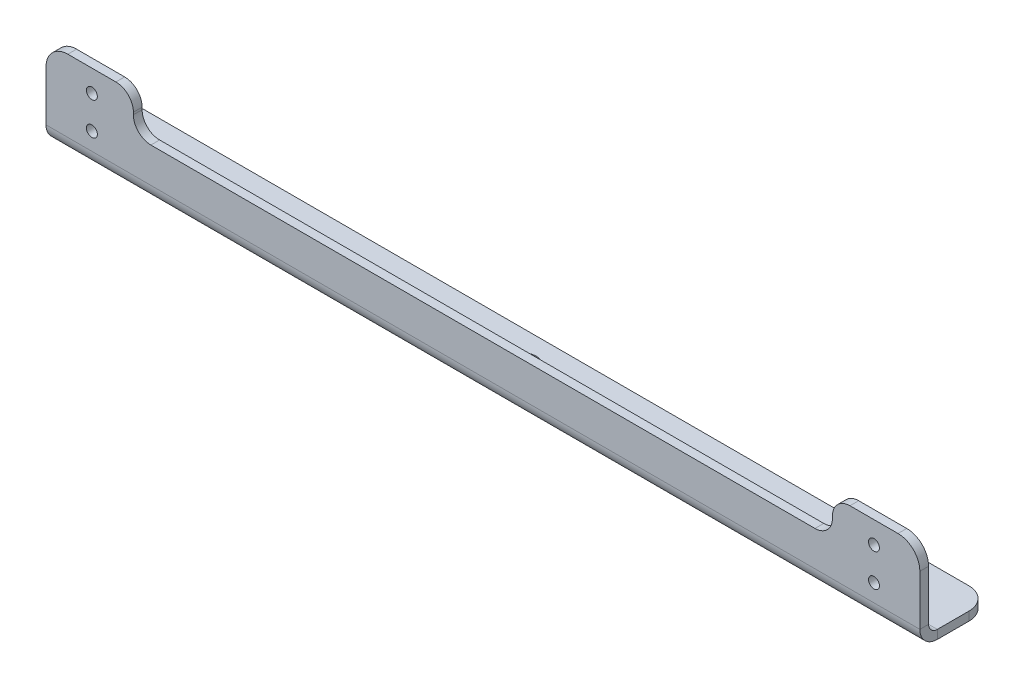
from build123d import *

# Parameters (mm, degrees)
BRIDA_BASE1_DEPTH             = 4
PLIEGUE_START                 = -1.07192
PLIEGUE_CROQUIZADO1_OUTLINE_W = 400
PLIEGUE_CROQUIZADO1_OUTLINE_H = 4
PLIEGUE_CROQUIZADO1_DEPTH     = 33.82192
PLIEGUE_START_2               = -4.25
PLIEGUE_CROQUIZADO1_2_DEPTH   = 0.02192
PLIEGUE_START_3               = -8.25
PLIEGUE_CROQUIZADO1_3_DEPTH   = 8
PLIEGUE_START_4               = -200
PLIEGUE_CROQUIZADO1_4_DEPTH   = 400
CROQUIS8_R                    = 7
CORTAR_EXTRUIR2_DEPTH         = 10
CORTAR_EXTRUIR3_REACH         = 207.381
CROQUIS9_R                    = 2.5


with BuildPart() as part:
    # Brida base1: sheet metal written as solids
    # Croquis1 → Brida base1 (new body)
    with BuildSketch(Plane(origin=(0, 0, 0), x_dir=(1, 0, 0), z_dir=(0, 1, 0))):
        with BuildLine():
            Line((168, -32.75), (190, -32.75))
            ThreePointArc((190, -32.75), (197.071067812, -29.821067812), (200, -22.75))
            Line((200, -22.75), (200, 22.75))
            ThreePointArc((200, 22.75), (197.071067812, 29.821067812), (190, 32.75))
            Line((190, 32.75), (-190, 32.75))
            ThreePointArc((-190, 32.75), (-197.071067812, 29.821067812), (-200, 22.75))
            Line((-200, 22.75), (-200, -22.75))
            ThreePointArc((-200, -22.75), (-197.071067812, -29.821067812), (-190, -32.75))
            Line((-190, -32.75), (-168, -32.75))
            ThreePointArc((-168, -32.75), (-162.343145751, -30.406854249), (-160, -24.75))
            Line((-160, -24.75), (-160, -23.75))
            ThreePointArc((-160, -23.75), (-157.656854249, -18.093145751), (-152, -15.75))
            Line((-152, -15.75), (152, -15.75))
            ThreePointArc((152, -15.75), (157.656854249, -18.093145751), (160, -23.75))
            Line((160, -23.75), (160, -24.75))
            ThreePointArc((160, -24.75), (162.343145751, -30.406854249), (168, -32.75))
        make_face()
    extrude(amount=-BRIDA_BASE1_DEPTH)

    # Pliegue croquizado1: read off the stored shape, not the designer's step
    # Pliegue croquizado1 outline → Pliegue croquizado1 (cut)
    with BuildSketch(Plane.XY.offset(PLIEGUE_START)):
        with Locations((0, -2)):
            Rectangle(PLIEGUE_CROQUIZADO1_OUTLINE_W, PLIEGUE_CROQUIZADO1_OUTLINE_H)
    extrude(amount=PLIEGUE_CROQUIZADO1_DEPTH, mode=Mode.SUBTRACT)

    # Pliegue croquizado1 2 outline → Pliegue croquizado1 2 (add)
    with BuildSketch(Plane.XY.offset(PLIEGUE_START_2)):
        with BuildLine():
            ThreePointArc((-190, 36.999999998), (-197.071067812, 34.07106781), (-200, 26.999999998))
            Line((-200, 26.999999998), (-200, 0))
            Line((-200, 0), (200, 0))
            Line((200, 0), (200, 26.999999998))
            ThreePointArc((200, 26.999999998), (197.071067812, 34.07106781), (190, 36.999999998))
            Line((190, 36.999999998), (168, 36.999999998))
            ThreePointArc((168, 36.999999998), (162.343145751, 34.656854247), (160, 28.999999998))
            Line((160, 28.999999998), (160, 27.999999998))
            ThreePointArc((160, 27.999999998), (157.656854249, 22.343145749), (152, 19.999999998))
            Line((152, 19.999999998), (-152, 19.999999998))
            ThreePointArc((-152, 19.999999998), (-157.656854249, 22.343145749), (-160, 27.999999998))
            Line((-160, 27.999999998), (-160, 28.999999998))
            ThreePointArc((-160, 28.999999998), (-162.343145751, 34.656854248), (-168, 36.999999998))
            Line((-168, 36.999999998), (-190, 36.999999998))
        make_face()
    extrude(amount=PLIEGUE_CROQUIZADO1_2_DEPTH)

    # Pliegue croquizado1 3 outline → Pliegue croquizado1 3 (add)
    with BuildSketch(Plane.XY.offset(PLIEGUE_START_3)):
        with BuildLine():
            ThreePointArc((-190, 36.999999998), (-197.071067812, 34.07106781), (-200, 26.999999998))
            Line((-200, 26.999999998), (-200, 0))
            Line((-200, 0), (200, 0))
            Line((200, 0), (200, 26.999999998))
            ThreePointArc((200, 26.999999998), (197.071067812, 34.07106781), (190, 36.999999998))
            Line((190, 36.999999998), (168, 36.999999998))
            ThreePointArc((168, 36.999999998), (162.343145751, 34.656854247), (160, 28.999999998))
            Line((160, 28.999999998), (160, 27.999999998))
            ThreePointArc((160, 27.999999998), (157.656854249, 22.343145749), (152, 19.999999998))
            Line((152, 19.999999998), (-152, 19.999999998))
            ThreePointArc((-152, 19.999999998), (-157.656854249, 22.343145749), (-160, 27.999999998))
            Line((-160, 27.999999998), (-160, 28.999999998))
            ThreePointArc((-160, 28.999999998), (-162.343145751, 34.656854248), (-168, 36.999999998))
            Line((-168, 36.999999998), (-190, 36.999999998))
        make_face()
    extrude(amount=PLIEGUE_CROQUIZADO1_3_DEPTH)

    # Pliegue croquizado1 4 outline → Pliegue croquizado1 4 (cut)
    with BuildSketch(Plane.YZ.offset(PLIEGUE_START_4)):
        with BuildLine():
            ThreePointArc((-4, -8.25), (-1.656854249, -2.593145751), (4, -0.25))
            Line((4, -0.25), (0, -0.25))
            Line((0, -0.25), (0, -1.07192))
            Line((0, -1.07192), (-4, -1.07192))
            Line((-4, -1.07192), (-4, -8.25))
        make_face()
        with BuildLine():
            ThreePointArc((4, -4.25), (1.171572875, -5.421572875), (0, -8.25))
            Line((0, -8.25), (36.999999998, -8.25))
            Line((36.999999998, -8.25), (36.999999998, -4.25))
            Line((36.999999998, -4.25), (4, -4.25))
        make_face()
    extrude(amount=PLIEGUE_CROQUIZADO1_4_DEPTH, mode=Mode.SUBTRACT)

    # Croquis8 → Cortar-Extruir2 (cut)
    with BuildSketch(Plane(origin=(0, 0, 0), x_dir=(1, 0, 0), z_dir=(0, 1, 0))):
        with Locations(Location((0, 17.75, 0), (0, 0, 270))):
            Circle(CROQUIS8_R)
    extrude(amount=-CORTAR_EXTRUIR2_DEPTH, mode=Mode.SUBTRACT)

    # Croquis9 → Cortar-Extruir3 (cut, up to next)
    with BuildSketch(Plane(origin=(0, 0, -4.25), x_dir=(-1, 0, 0), z_dir=(0, 0, -1)), mode=Mode.PRIVATE) as cortar_extruir3_sk1:
        with Locations(Location((179, 11.999999998, 0), (0, 0, 90))):
            Circle(CROQUIS9_R)
    cortar_extruir3_tool1 = extrude(cortar_extruir3_sk1.sketch, amount=-CORTAR_EXTRUIR3_REACH, mode=Mode.PRIVATE) & part.part
    # Croquis9 → Cortar-Extruir3 (cut, up to next)
    with BuildSketch(Plane(origin=(0, 0, -4.25), x_dir=(-1, 0, 0), z_dir=(0, 0, -1)), mode=Mode.PRIVATE) as cortar_extruir3_sk2:
        with Locations(Location((179, 26.999999998, 0), (0, 0, 90))):
            Circle(CROQUIS9_R)
    cortar_extruir3_tool2 = extrude(cortar_extruir3_sk2.sketch, amount=-CORTAR_EXTRUIR3_REACH, mode=Mode.PRIVATE) & part.part
    # Croquis9 → Cortar-Extruir3 (cut, up to next)
    with BuildSketch(Plane(origin=(0, 0, -4.25), x_dir=(-1, 0, 0), z_dir=(0, 0, -1)), mode=Mode.PRIVATE) as cortar_extruir3_sk3:
        with Locations(Location((-179, 26.999999998, 0), (0, 0, 90))):
            Circle(CROQUIS9_R)
    cortar_extruir3_tool3 = extrude(cortar_extruir3_sk3.sketch, amount=-CORTAR_EXTRUIR3_REACH, mode=Mode.PRIVATE) & part.part
    # Croquis9 → Cortar-Extruir3 (cut, up to next)
    with BuildSketch(Plane(origin=(0, 0, -4.25), x_dir=(-1, 0, 0), z_dir=(0, 0, -1)), mode=Mode.PRIVATE) as cortar_extruir3_sk4:
        with Locations(Location((-179, 11.999999998, 0), (0, 0, 90))):
            Circle(CROQUIS9_R)
    cortar_extruir3_tool4 = extrude(cortar_extruir3_sk4.sketch, amount=-CORTAR_EXTRUIR3_REACH, mode=Mode.PRIVATE) & part.part
    add(cortar_extruir3_tool1.solids().sort_by_distance((-179, 12, -4.25))[0], mode=Mode.SUBTRACT)
    add(cortar_extruir3_tool2.solids().sort_by_distance((-179, 27, -4.25))[0], mode=Mode.SUBTRACT)
    add(cortar_extruir3_tool3.solids().sort_by_distance((179, 27, -4.25))[0], mode=Mode.SUBTRACT)
    add(cortar_extruir3_tool4.solids().sort_by_distance((179, 12, -4.25))[0], mode=Mode.SUBTRACT)


solid = part.part
